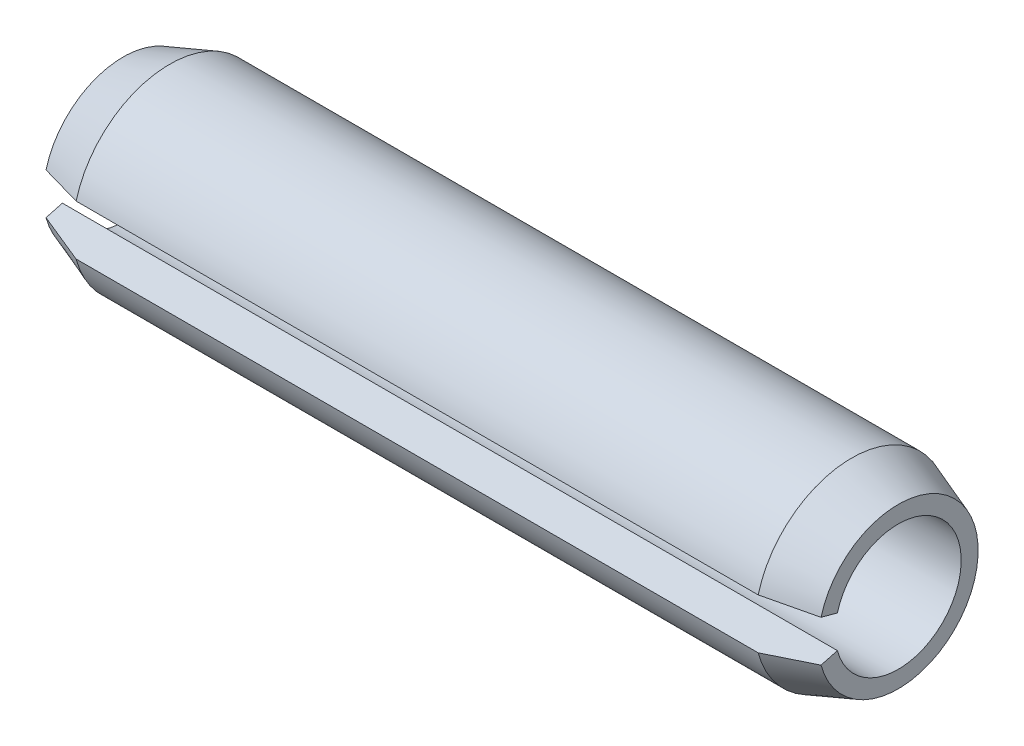
from build123d import *

# Parameters (mm, degrees)
SLIT_DEPTH = 41.620192023


with BuildPart() as part:
    # BodySke → BaseBody (revolve)
    with BuildSketch(Plane(origin=(0, 0, 0), x_dir=(1, 0, 0), z_dir=(0, 1, 0))):
        Polygon((0, 3.25), (40, 3.25), (40, 4.125), (37.6, 5), (2.4, 5), (0, 4.125), align=None)
    revolve(axis=Axis((0, 0, 0), (1, 0, 0)))

    # SlitSke → Slit (cut, through all)
    with BuildSketch(Plane(origin=(0, 0, 0), x_dir=(0, 0, -1), z_dir=(1, 0, 0))):
        with BuildLine():
            Line((0, 0), (-4.829629131, 1.294095226))
            ThreePointArc((-4.829629131, 1.294095226), (-5, 0), (-4.829629131, -1.294095226))
            Line((-4.829629131, -1.294095226), (0, 0))
        make_face()
    extrude(amount=SLIT_DEPTH, mode=Mode.SUBTRACT)


solid = part.part
